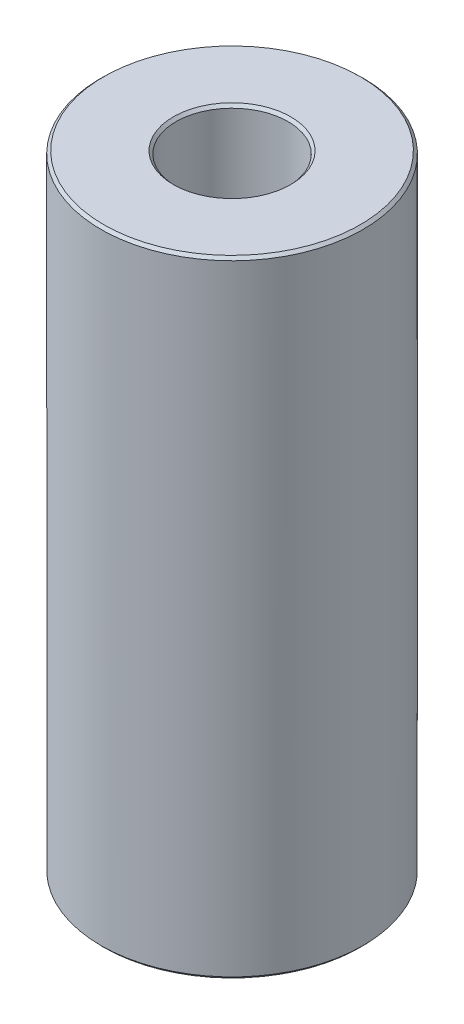
from build123d import *
from OCP.BRepFilletAPI import BRepFilletAPI_MakeChamfer

# Parameters (mm, degrees)
SKETCH1_R           = 60
BOSS_EXTRUDE1_DEPTH = 286.398965544
SKETCH2_R           = 25.657814221
CUT_EXTRUDE1_DEPTH  = 299.704481829
CHAMFER1_SIZE       = 1.222367693
CHAMFER1_SIZE2      = 1.297039235


with BuildPart() as part:
    # Sketch1 → Boss-Extrude1 (new body)
    with BuildSketch(Plane(origin=(0, 0, 0), x_dir=(1, 0, 0), z_dir=(0, 1, 0))):
        Circle(SKETCH1_R)
    extrude(amount=BOSS_EXTRUDE1_DEPTH)

    # Sketch2 → Cut-Extrude1 (cut, through all)
    with BuildSketch(Plane(origin=(0, 0, 0), x_dir=(1, 0, 0), z_dir=(0, 1, 0))):
        Circle(SKETCH2_R)
    extrude(amount=CUT_EXTRUDE1_DEPTH, mode=Mode.SUBTRACT)

    # Chamfer1: one chamfer whose edges measure the first distance from different faces: ONE call of the kernel's chamfer builder (chamfer() names one face for all edges)
    chamfer1_edges_1 = [part.edges().sort_by_distance(p)[0] for p in [
        (-25.657814221, 286.398965544, 0),
    ]]
    chamfer1_side_1 = [part.faces().sort_by_distance(p)[0] for p in [
        (-58.302943725, 286.398965544, 0),
    ]]
    chamfer1_edges_2 = [part.edges().sort_by_distance(p)[0] for p in [
        (-25.657814221, 0, 0),
    ]]
    chamfer1_side_2 = [part.faces().sort_by_distance(p)[0] for p in [
        (-25.657814221, 143.199482772, 0),
    ]]
    chamfer1_edges_3 = [part.edges().sort_by_distance(p)[0] for p in [
        (-60, 0, 0),
    ]]
    chamfer1_side_3 = [part.faces().sort_by_distance(p)[0] for p in [
        (-58.302943725, 0, 0),
    ]]
    chamfer1_edges_4 = [part.edges().sort_by_distance(p)[0] for p in [
        (-60, 286.398965544, 0),
    ]]
    chamfer1_side_4 = [part.faces().sort_by_distance(p)[0] for p in [
        (-60, 143.199482772, 0),
    ]]
    chamfer1 = BRepFilletAPI_MakeChamfer(part.part.solid().wrapped)
    for e in chamfer1_edges_1:
        chamfer1.Add(CHAMFER1_SIZE, CHAMFER1_SIZE2, e.wrapped, chamfer1_side_1[0].wrapped)  # the first distance lies on this face
    for e in chamfer1_edges_2:
        chamfer1.Add(CHAMFER1_SIZE, CHAMFER1_SIZE2, e.wrapped, chamfer1_side_2[0].wrapped)  # the first distance lies on this face
    for e in chamfer1_edges_3:
        chamfer1.Add(CHAMFER1_SIZE, CHAMFER1_SIZE2, e.wrapped, chamfer1_side_3[0].wrapped)  # the first distance lies on this face
    for e in chamfer1_edges_4:
        chamfer1.Add(CHAMFER1_SIZE, CHAMFER1_SIZE2, e.wrapped, chamfer1_side_4[0].wrapped)  # the first distance lies on this face
    add(Compound.cast(chamfer1.Shape()), mode=Mode.REPLACE)


solid = part.part
